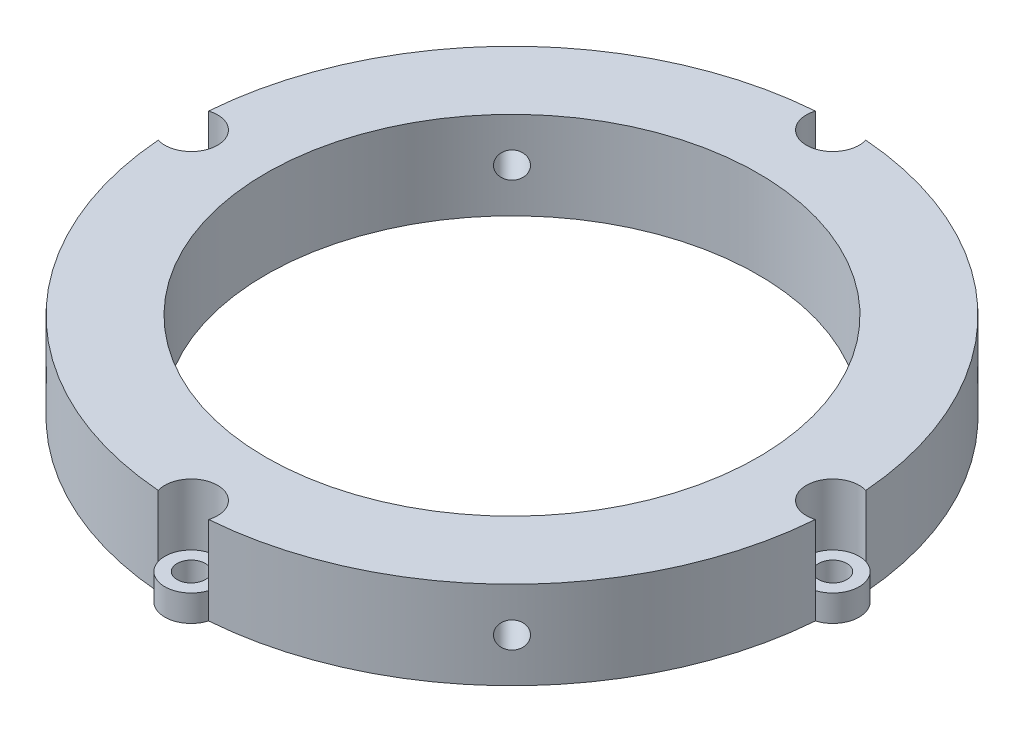
from build123d import *

# Parameters (mm, degrees)
IZIM2_R                     = 28
Y_KSEKLIK_EKSTR_ZYON5_DEPTH = 10
IZIM3_R                     = 1.49
KES_EKSTR_ZYON1_DEPTH       = 54.801017528
DAIRESEL_KAPLAMA1_COUNT     = 4
IZIM4_R                     = 3
IZIM4_R_2                   = 1.6
Y_KSEKLIK_EKSTR_ZYON6_DEPTH = 3
DAIRESEL_KAPLAMA2_COUNT     = 4


with BuildPart() as part:
    # Çizim2 → Yükseklik-Ekstrüzyon5 (new body)
    # profile 1 of 4: a face of its own
    with BuildSketch(Plane(origin=(0, 0, 0), x_dir=(1, 0, 0), z_dir=(0, 1, 0))):
        with BuildLine():
            ThreePointArc((-37.380138356, 2.867988228), (-33.5, 0), (-37.380138356, -2.867988228))
            ThreePointArc((-37.380138356, -2.867988228), (-26.509433227, -26.509433227), (-2.867988228, -37.380138356))
            ThreePointArc((-2.867988228, -37.380138356), (0, -33.5), (2.867988228, -37.380138356))
            ThreePointArc((2.867988228, -37.380138356), (26.509433227, -26.509433227), (37.380138356, -2.867988228))
            ThreePointArc((37.380138356, -2.867988228), (33.5, 0), (37.380138356, 2.867988228))
            ThreePointArc((37.380138356, 2.867988228), (26.509433227, 26.509433227), (2.867988228, 37.380138356))
            ThreePointArc((2.867988228, 37.380138356), (0, 33.5), (-2.867988228, 37.380138356))
            ThreePointArc((-2.867988228, 37.380138356), (-26.509433227, 26.509433227), (-37.380138356, 2.867988228))
        make_face()
        Circle(IZIM2_R, mode=Mode.SUBTRACT)
    # profile 2 of 4: a face of its own
    with BuildSketch(Plane(origin=(0, 0, 0), x_dir=(1, 0, 0), z_dir=(0, 1, 0))):
        with BuildLine():
            ThreePointArc((-37.380138356, 2.867988228), (-33.5, 0), (-37.380138356, -2.867988228))
            ThreePointArc((-37.380138356, -2.867988228), (-26.509433227, -26.509433227), (-2.867988228, -37.380138356))
            ThreePointArc((-2.867988228, -37.380138356), (0, -33.5), (2.867988228, -37.380138356))
            ThreePointArc((2.867988228, -37.380138356), (26.509433227, -26.509433227), (37.380138356, -2.867988228))
            ThreePointArc((37.380138356, -2.867988228), (33.5, 0), (37.380138356, 2.867988228))
            ThreePointArc((37.380138356, 2.867988228), (26.509433227, 26.509433227), (2.867988228, 37.380138356))
            ThreePointArc((2.867988228, 37.380138356), (0, 33.5), (-2.867988228, 37.380138356))
            ThreePointArc((-2.867988228, 37.380138356), (-26.509433227, 26.509433227), (-37.380138356, 2.867988228))
        make_face()
        Circle(IZIM2_R, mode=Mode.SUBTRACT)
    # profile 3 of 4: a face of its own
    with BuildSketch(Plane(origin=(0, 0, 0), x_dir=(1, 0, 0), z_dir=(0, 1, 0))):
        with BuildLine():
            ThreePointArc((-37.380138356, 2.867988228), (-33.5, 0), (-37.380138356, -2.867988228))
            ThreePointArc((-37.380138356, -2.867988228), (-26.509433227, -26.509433227), (-2.867988228, -37.380138356))
            ThreePointArc((-2.867988228, -37.380138356), (0, -33.5), (2.867988228, -37.380138356))
            ThreePointArc((2.867988228, -37.380138356), (26.509433227, -26.509433227), (37.380138356, -2.867988228))
            ThreePointArc((37.380138356, -2.867988228), (33.5, 0), (37.380138356, 2.867988228))
            ThreePointArc((37.380138356, 2.867988228), (26.509433227, 26.509433227), (2.867988228, 37.380138356))
            ThreePointArc((2.867988228, 37.380138356), (0, 33.5), (-2.867988228, 37.380138356))
            ThreePointArc((-2.867988228, 37.380138356), (-26.509433227, 26.509433227), (-37.380138356, 2.867988228))
        make_face()
        Circle(IZIM2_R, mode=Mode.SUBTRACT)
    # profile 4 of 4: a face of its own
    with BuildSketch(Plane(origin=(0, 0, 0), x_dir=(1, 0, 0), z_dir=(0, 1, 0))):
        with BuildLine():
            ThreePointArc((-2.867988228, 37.380138356), (0, 33.5), (2.867988228, 37.380138356))
            ThreePointArc((2.867988228, 37.380138356), (26.509433227, 26.509433227), (37.380138356, 2.867988228))
            ThreePointArc((37.380138356, 2.867988228), (33.5, 0), (37.380138356, -2.867988228))
            ThreePointArc((37.380138356, -2.867988228), (26.509433227, -26.509433227), (2.867988228, -37.380138356))
            ThreePointArc((2.867988228, -37.380138356), (0, -33.5), (-2.867988228, -37.380138356))
            ThreePointArc((-2.867988228, -37.380138356), (-26.509433227, -26.509433227), (-37.380138356, -2.867988228))
            ThreePointArc((-37.380138356, -2.867988228), (-33.5, 0), (-37.380138356, 2.867988228))
            ThreePointArc((-37.380138356, 2.867988228), (-26.509433227, 26.509433227), (-2.867988228, 37.380138356))
        make_face()
        Circle(IZIM2_R, mode=Mode.SUBTRACT)
    extrude(amount=Y_KSEKLIK_EKSTR_ZYON5_DEPTH)

    # Çizim3 → Kes-Ekstrüzyon1 (cut, through all)
    with BuildSketch(Plane(origin=(0, 0, 0), x_dir=(0.7071067811865464, 0, 0.7071067811865488), z_dir=(-0.7071067811865488, 0, 0.7071067811865464))):
        with Locations((0, 5)):
            Circle(IZIM3_R)
    kes_ekstr_zyon1 = extrude(amount=-KES_EKSTR_ZYON1_DEPTH, mode=Mode.SUBTRACT)

    # Dairesel Kaplama1: Kes-Ekstrüzyon1 ×4 about axis
    dairesel_kaplama1_axis = Axis((0, 31.917325532, 0), (0, -1, 0))
    for i in range(1, DAIRESEL_KAPLAMA1_COUNT):
        add(kes_ekstr_zyon1.rotate(dairesel_kaplama1_axis, i * 360 / DAIRESEL_KAPLAMA1_COUNT), mode=Mode.SUBTRACT)

    # Çizim4 → Yükseklik-Ekstrüzyon6 (add)
    with BuildSketch(Plane(origin=(0, 0, 0), x_dir=(1, 0, 0), z_dir=(0, 1, 0))):
        with Locations((-36.5, 0)):
            Circle(IZIM4_R)
        with Locations((-36.5, 0)):
            Circle(IZIM4_R_2, mode=Mode.SUBTRACT)
    y_kseklik_ekstr_zyon6 = extrude(amount=Y_KSEKLIK_EKSTR_ZYON6_DEPTH)

    # Dairesel Kaplama2: Yükseklik-Ekstrüzyon6 ×4 about axis
    dairesel_kaplama2_axis = Axis((0, 31.917325532, 0), (0, -1, 0))
    for i in range(1, DAIRESEL_KAPLAMA2_COUNT):
        add(y_kseklik_ekstr_zyon6.rotate(dairesel_kaplama2_axis, i * 360 / DAIRESEL_KAPLAMA2_COUNT))


solid = part.part
